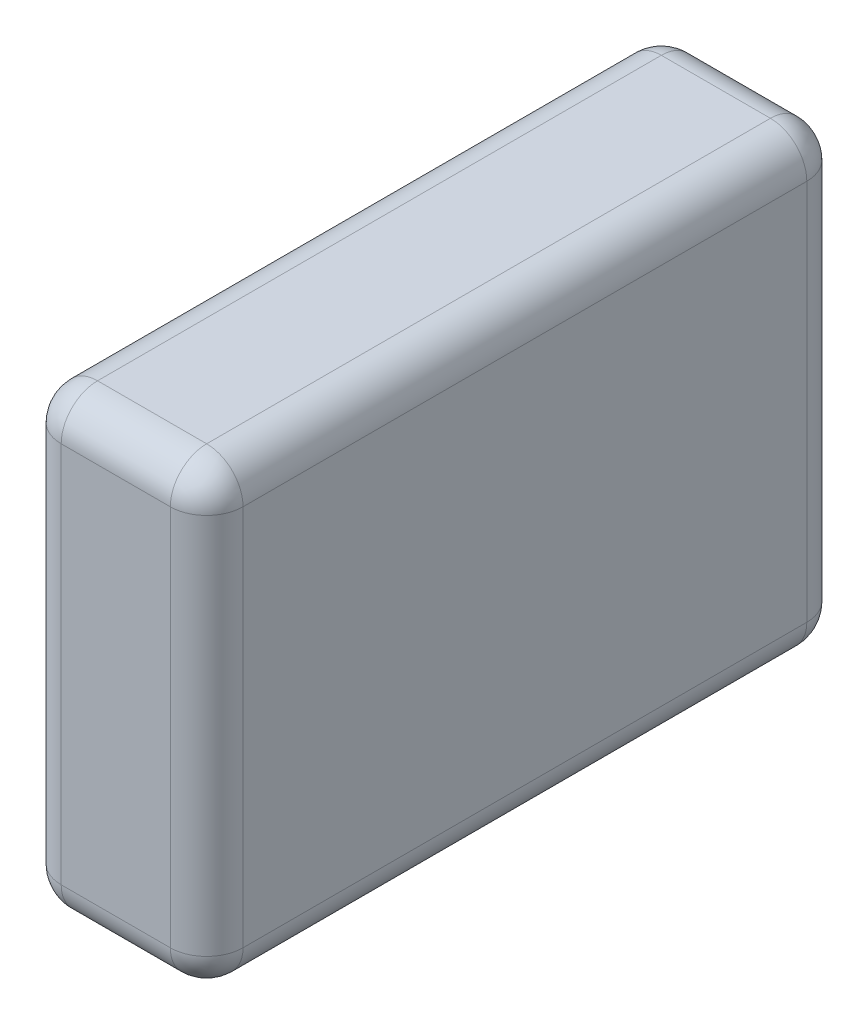
from build123d import *

# Parameters (mm, degrees)
SKETCH_1_W      = 70
SKETCH_1_H      = 50
EXTRUDE_1_DEPTH = 20
FILLET_1_R      = 4
FILLET_2_R      = 4
FILLET_3_R      = 4


with BuildPart() as part:
    # 草图1 → 凸台-拉伸1 (new body)
    with BuildSketch(Plane(origin=(0, 0, 0), x_dir=(0, 0, -1), z_dir=(1, 0, 0))):
        with Locations((35, -25)):
            Rectangle(SKETCH_1_W, SKETCH_1_H)
    extrude(amount=EXTRUDE_1_DEPTH)

    # 圆角1
    fillet_1_edges = [part.edges().sort_by_distance(p)[0] for p in [
        (0, 0, -35),
        (0, -25, -70),
        (0, -50, -35),
        (0, -25, 0),
    ]]
    fillet(fillet_1_edges, radius=FILLET_1_R)

    # 圆角2
    fillet_2_edges = [part.edges().sort_by_distance(p)[0] for p in [
        (20, -25, -70),
        (20, 0, -35),
        (20, -25, 0),
        (20, -50, -35),
    ]]
    fillet(fillet_2_edges, radius=FILLET_2_R)

    # 圆角3
    # the kernel refuses this fillet: 4 mm, written as the material it takes off along each edge
    with BuildSketch(Plane(origin=(4, -46, -4), x_dir=(0, -1, 0), z_dir=(0, 0, 1))) as fillet_3_piece_1_section:
        Polygon((0, 0), (FILLET_3_R, 0), (FILLET_3_R, -FILLET_3_R), (0, -FILLET_3_R), align=None)
    fillet_3_piece_1 = extrude(amount=FILLET_3_R, mode=Mode.PRIVATE)
    fillet_3_piece_1 = fillet_3_piece_1 - Plane(origin=(4, -46, -4), x_dir=(0.7071067811865475, 0.7071067811865475, 0), z_dir=(0, 0, 1)) * Sphere(FILLET_3_R, mode=Mode.PRIVATE)
    add(fillet_3_piece_1, mode=Mode.SUBTRACT)
    with BuildSketch(Plane(origin=(4, -4, -4), x_dir=(0, 0, 1), z_dir=(0, 1, 0))) as fillet_3_piece_2_section:
        Polygon((0, 0), (FILLET_3_R, 0), (FILLET_3_R, -FILLET_3_R), (0, -FILLET_3_R), align=None)
    fillet_3_piece_2 = extrude(amount=FILLET_3_R, mode=Mode.PRIVATE)
    fillet_3_piece_2 = fillet_3_piece_2 - Plane(origin=(4, -4, -4), x_dir=(0.7071067811865475, 0, -0.7071067811865475), z_dir=(0, 1, 0)) * Sphere(FILLET_3_R, mode=Mode.PRIVATE)
    add(fillet_3_piece_2, mode=Mode.SUBTRACT)
    with BuildSketch(Plane(origin=(4, -46, -66), x_dir=(0, -1, 0), z_dir=(0, 0, -1))) as fillet_3_piece_3_section:
        Polygon((0, 0), (FILLET_3_R, 0), (FILLET_3_R, FILLET_3_R), (0, FILLET_3_R), align=None)
    fillet_3_piece_3 = extrude(amount=FILLET_3_R, mode=Mode.PRIVATE)
    fillet_3_piece_3 = fillet_3_piece_3 - Plane(origin=(4, -46, -66), x_dir=(0.7071067811865475, 0.7071067811865475, 0), z_dir=(0, 0, -1)) * Sphere(FILLET_3_R, mode=Mode.PRIVATE)
    add(fillet_3_piece_3, mode=Mode.SUBTRACT)
    with BuildSketch(Plane(origin=(4, -4, -66), x_dir=(0, 0, -1), z_dir=(0, 1, 0))) as fillet_3_piece_4_section:
        Polygon((0, 0), (FILLET_3_R, 0), (FILLET_3_R, FILLET_3_R), (0, FILLET_3_R), align=None)
    fillet_3_piece_4 = extrude(amount=FILLET_3_R, mode=Mode.PRIVATE)
    fillet_3_piece_4 = fillet_3_piece_4 - Plane(origin=(4, -4, -66), x_dir=(0.7071067811865475, 0, 0.7071067811865475), z_dir=(0, 1, 0)) * Sphere(FILLET_3_R, mode=Mode.PRIVATE)
    add(fillet_3_piece_4, mode=Mode.SUBTRACT)
    with BuildSketch(Plane(origin=(16, -4, -66), x_dir=(0, 0, -1), z_dir=(0, 1, 0))) as fillet_3_piece_5_section:
        Polygon((0, 0), (FILLET_3_R, 0), (FILLET_3_R, -FILLET_3_R), (0, -FILLET_3_R), align=None)
    fillet_3_piece_5 = extrude(amount=FILLET_3_R, mode=Mode.PRIVATE)
    fillet_3_piece_5 = fillet_3_piece_5 - Plane(origin=(16, -4, -66), x_dir=(-0.7071067811865475, 0, 0.7071067811865475), z_dir=(0, 1, 0)) * Sphere(FILLET_3_R, mode=Mode.PRIVATE)
    add(fillet_3_piece_5, mode=Mode.SUBTRACT)
    with BuildSketch(Plane(origin=(16, -46, -66), x_dir=(0, -1, 0), z_dir=(0, 0, -1))) as fillet_3_piece_6_section:
        Polygon((0, 0), (FILLET_3_R, 0), (FILLET_3_R, -FILLET_3_R), (0, -FILLET_3_R), align=None)
    fillet_3_piece_6 = extrude(amount=FILLET_3_R, mode=Mode.PRIVATE)
    fillet_3_piece_6 = fillet_3_piece_6 - Plane(origin=(16, -46, -66), x_dir=(-0.7071067811865475, 0.7071067811865475, 0), z_dir=(0, 0, -1)) * Sphere(FILLET_3_R, mode=Mode.PRIVATE)
    add(fillet_3_piece_6, mode=Mode.SUBTRACT)
    with BuildSketch(Plane(origin=(16, -4, -4), x_dir=(0, 0, 1), z_dir=(0, 1, 0))) as fillet_3_piece_7_section:
        Polygon((0, 0), (FILLET_3_R, 0), (FILLET_3_R, FILLET_3_R), (0, FILLET_3_R), align=None)
    fillet_3_piece_7 = extrude(amount=FILLET_3_R, mode=Mode.PRIVATE)
    fillet_3_piece_7 = fillet_3_piece_7 - Plane(origin=(16, -4, -4), x_dir=(-0.7071067811865475, 0, -0.7071067811865475), z_dir=(0, 1, 0)) * Sphere(FILLET_3_R, mode=Mode.PRIVATE)
    add(fillet_3_piece_7, mode=Mode.SUBTRACT)
    with BuildSketch(Plane(origin=(16, -46, -4), x_dir=(0, -1, 0), z_dir=(0, 0, 1))) as fillet_3_piece_8_section:
        Polygon((0, 0), (FILLET_3_R, 0), (FILLET_3_R, FILLET_3_R), (0, FILLET_3_R), align=None)
    fillet_3_piece_8 = extrude(amount=FILLET_3_R, mode=Mode.PRIVATE)
    fillet_3_piece_8 = fillet_3_piece_8 - Plane(origin=(16, -46, -4), x_dir=(-0.7071067811865475, 0.7071067811865475, 0), z_dir=(0, 0, 1)) * Sphere(FILLET_3_R, mode=Mode.PRIVATE)
    add(fillet_3_piece_8, mode=Mode.SUBTRACT)
    with BuildSketch(Plane(origin=(4, 0, 0), x_dir=(0, 0, -1), z_dir=(1, 0, 0)), Plane(origin=(4, -50, 0), x_dir=(0, 1, 0), z_dir=(1, 0, 0))) as fillet_3_piece_9:
        with BuildLine():
            CenterArc((FILLET_3_R, -FILLET_3_R), FILLET_3_R, 90, 90)
            Line((0, -FILLET_3_R), (0, 0))
            Line((0, 0), (FILLET_3_R, 0))
        make_face()
    extrude(amount=12, mode=Mode.SUBTRACT)
    with BuildSketch(Plane(origin=(4, -50, -70), x_dir=(0, 1, 0), z_dir=(1, 0, 0)), Plane(origin=(4, 0, -70), x_dir=(0, 0, 1), z_dir=(1, 0, 0))) as fillet_3_piece_10:
        with BuildLine():
            CenterArc((FILLET_3_R, FILLET_3_R), FILLET_3_R, 180, 90)
            Line((0, FILLET_3_R), (0, 0))
            Line((0, 0), (FILLET_3_R, 0))
        make_face()
    extrude(amount=12, mode=Mode.SUBTRACT)


solid = part.part
